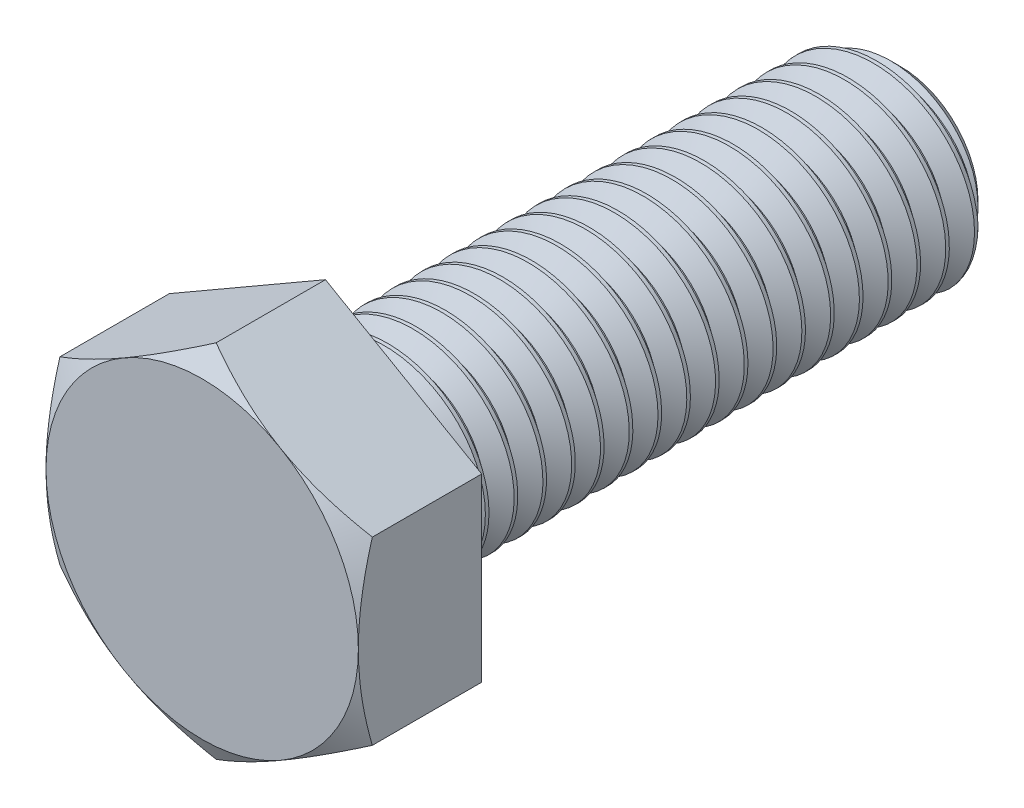
from build123d import *

# Parameters (mm, degrees)
BOSS_EXTRUDE1_DEPTH = 7.5
SKETCH4_OUTSIDE_W   = 190.326
SKETCH4_OUTSIDE_H   = 193.266
SKETCH4_OUTSIDE_R   = 9.5
CUT_EXTRUDE1_DEPTH  = 45.909167587
CUT_EXTRUDE1_DRAFT  = -60
CUT_SWEEP1_PITCH    = 1.75
CUT_SWEEP1_TO       = 35


with BuildPart() as part:
    # Sketch2 → Revolve1 (revolve)
    with BuildSketch(Plane(origin=(0, 0, 0), x_dir=(0, 0, -1), z_dir=(1, 0, 0)), mode=Mode.PRIVATE) as revolve1_sk:
        Polygon((-21.25, 9.5), (-21.25, 0), (21.25, 0), (21.25, 4.6875), (19.9375, 6), (-13.75, 6), (-13.75, 9.5), align=None)
    revolve(revolve1_sk.sketch.rotate(Axis((0, 0, 21.25), (0, 0, -1)), 90), axis=Axis((0, 0, 21.25), (0, 0, -1)))

    # Sketch3 → Boss-Extrude1 (add)
    with BuildSketch(Plane.XY.offset(21.25)):
        Polygon((0, 10.969655115), (-9.5, 5.484827557), (-9.5, -5.484827557), (0, -10.969655115), (9.5, -5.484827557), (9.5, 5.484827557), align=None)
    extrude(amount=-BOSS_EXTRUDE1_DEPTH)


with BuildPart() as cut_extrude1_tool:
    # Sketch4 outside → Cut-Extrude1 (with draft: the straight prism first)
    with BuildSketch(Plane.XY.offset(21.25)):
        Rectangle(SKETCH4_OUTSIDE_W, SKETCH4_OUTSIDE_H)
        Circle(SKETCH4_OUTSIDE_R, mode=Mode.SUBTRACT)
    extrude(amount=-CUT_EXTRUDE1_DEPTH)
    # Cut-Extrude1: the draft: its side faces are tilted about the plane it starts from
    cut_extrude1_sides = [cut_extrude1_tool.faces().sort_by_distance(p)[0] for p in [
        (0, -96.633, -1.704583793),
        (95.163, 0, -1.704583793),
        (0, 96.633, -1.704583793),
        (-95.163, 0, -1.704583793),
        (-9.5, 0, -1.704583793),
    ]]
    draft(cut_extrude1_sides, Plane.XY.offset(21.25), CUT_EXTRUDE1_DRAFT)


with BuildPart() as part_1:
    add(part.part)

    # Cut-Extrude1: cut by cut_extrude1_tool
    add(cut_extrude1_tool.part, mode=Mode.SUBTRACT)


with BuildPart() as body_2:
    # Split1: read off the stored shape, not the designer's step
    # Split1: the piece on the far side of the plane
    add(part_1.part)
    split(bisect_by=Plane.XY.offset(13.75), keep=Keep.BOTTOM)

    # Cut-Sweep1: arcs per turn and ends read off the stored shape
    # Cut-Sweep1: the profile of Sketch7 screwed along a right-hand helix through 21 turns, 10 arcs to a turn; built about Z, then put on its axis
    cut_sweep1_z = Axis((0, 0, 0), (0, 0, 1))
    cut_sweep1_corners = [(6.094721529, 0, 0.0546875), (4.863341658, 0, -0.65625), (4.863341658, 0, -0.875), (6.094721529, 0, -1.5859375)]
    with BuildLine(mode=Mode.PRIVATE) as cut_sweep1_profile:
        Line(cut_sweep1_corners[0], cut_sweep1_corners[1])
        Line(cut_sweep1_corners[1], cut_sweep1_corners[2])
        Line(cut_sweep1_corners[2], cut_sweep1_corners[3])
        Line(cut_sweep1_corners[3], cut_sweep1_corners[0])
    cut_sweep1_cap = Face(cut_sweep1_profile.wire())
    cut_sweep1_turn_angles = [0, 18, 36, 54, 72, 90, 108, 126, 144, 162, 180, 198, 216, 234, 252, 270, 288, 306, 324, 342, 360]
    cut_sweep1_turn_weights = [1, 0.9510565162951535, 1, 0.9510565162951535, 1, 0.9510565162951535, 1, 0.9510565162951535, 1, 0.9510565162951535, 1, 0.9510565162951535, 1, 0.9510565162951535, 1, 0.9510565162951535, 1, 0.9510565162951535, 1, 0.9510565162951535, 1]
    cut_sweep1_turn_rails = [Edge.make_bspline([Vector(p[0], p[1], 0).rotate(cut_sweep1_z, cut_sweep1_turn_angles[k]) / cut_sweep1_turn_weights[k] + Vector(0, 0, p[2] + CUT_SWEEP1_PITCH * cut_sweep1_turn_angles[k] / 360) for k in range(21)], [0, 0, 0, 1, 1, 2, 2, 3, 3, 4, 4, 5, 5, 6, 6, 7, 7, 8, 8, 9, 9, 10, 10, 10], 2, cut_sweep1_turn_weights) for p in cut_sweep1_corners]
    cut_sweep1_turn_sides = [Face.make_surface_from_curves(cut_sweep1_turn_rails[p[0]], cut_sweep1_turn_rails[p[1]]) for p in [(0, 1), (1, 2), (2, 3), (3, 0)]]
    cut_sweep1 = Plane(origin=(0, 0, -21.25), x_dir=(0, 1, 0), z_dir=(0, 0, 1)) * split(Solid(Shell([*[p.moved(Location((0, 0, CUT_SWEEP1_PITCH * i))) for i in range(21) for p in cut_sweep1_turn_sides], cut_sweep1_cap, cut_sweep1_cap.rotate(cut_sweep1_z, 7560).moved(Location((0, 0, CUT_SWEEP1_PITCH * 7560 / 360)))])), bisect_by=Plane.XY.offset(CUT_SWEEP1_TO), keep=Keep.BOTTOM, mode=Mode.PRIVATE)
    add(cut_sweep1, mode=Mode.SUBTRACT)


with BuildPart() as part_2:
    add(part_1.part)

    # Split1
    split(bisect_by=Plane.XY.offset(13.75), keep=Keep.TOP)

    add(body_2.part)  # Boss-Extrude2 merges body 2
    # Boss-Extrude2: read off the stored shape, not the designer's step
    # Boss-Extrude2 outline → Boss-Extrude2 (revolve)
    with BuildSketch(Plane.XZ):
        Polygon((4.863341163, 13.75), (4.863341163, 10.627055511), (6, 13.75), align=None)
    revolve(axis=Axis((0, 0, 0), (0, 0, 1)))


solid = part_2.part
